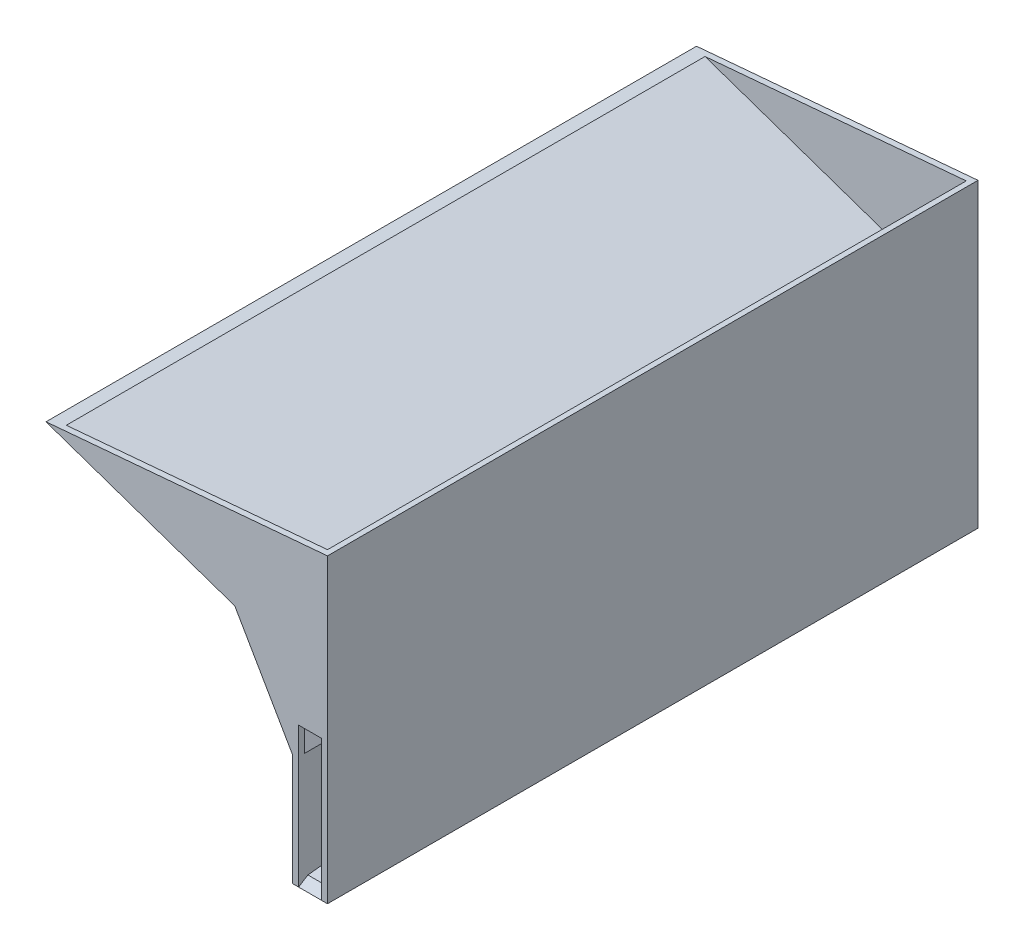
from build123d import *

# Parameters (mm, degrees)
BOSS_EXTRUDE1_DEPTH = 701.675
SHELL1_T            = -12.7
SKETCH3_W           = 49.6
SKETCH3_H           = 290
CUT_EXTRUDE1_DEPTH  = 20
BOSS_EXTRUDE2_REACH = 980.494
CHAMFER1_SIZE       = 12.7
CHAMFER1_SIZE_2     = 20


with BuildPart() as part:
    # Sketch2 → Boss-Extrude1 (new, symmetric)
    with BuildSketch(Plane.XY):
        Polygon((0, 0), (-125, 216.506350946), (-532.280287957, 356.869859221), (75, 410), (75, -240), (0, -240), align=None)
    extrude(amount=BOSS_EXTRUDE1_DEPTH, both=True)

    # Shell1
    shell1_openings = [part.faces().sort_by_distance(p)[0] for p in [
        (-228.640143978, 383.434929611, 0),
    ]]
    offset(amount=SHELL1_T, openings=shell1_openings, kind=Kind.INTERSECTION)

    # Sketch3 → Cut-Extrude1 (cut)
    with BuildSketch(Plane.XY.offset(701.675)):
        with Locations((37.5, -82.3)):
            Rectangle(SKETCH3_W, SKETCH3_H)
    extrude(amount=-CUT_EXTRUDE1_DEPTH, mode=Mode.SUBTRACT)

    # Sketch4 → Boss-Extrude2 (add, up to next)
    with BuildSketch(Plane(origin=(12.7, 0, 0), x_dir=(0, 0, -1), z_dir=(1, 0, 0)), mode=Mode.PRIVATE) as boss_extrude2_sk1:
        Polygon((688.975, -227.3), (688.975, -83.238879933), (-681.675, -227.3), align=None)
    boss_extrude2_tool1 = extrude(boss_extrude2_sk1.sketch, amount=BOSS_EXTRUDE2_REACH, mode=Mode.PRIVATE) - part.part
    add(boss_extrude2_tool1.solids().sort_by_distance((12.7, -179.279627, -232.091667))[0])

    # Chamfer1
    # the kernel refuses this chamfer: 20, 12.7 mm, written as the material it adds along each edge
    # the kernel refuses this chamfer: 20, 12.7 mm, written as the material it takes off along each edge
    with BuildSketch(Plane(origin=(12.7, -227.3, 701.675), x_dir=(0, -0.9986795899881412, 0.05137194313161755), z_dir=(1, 0, 0))) as chamfer1_2_piece_1:
        Polygon((CHAMFER1_SIZE * 0.998679589988, CHAMFER1_SIZE * 0.0513719431316), (-CHAMFER1_SIZE_2 * 0.0513719431316, CHAMFER1_SIZE_2 * 0.998679589988), (0, 0), align=None)
    extrude(amount=49.6, mode=Mode.SUBTRACT)


solid = part.part
